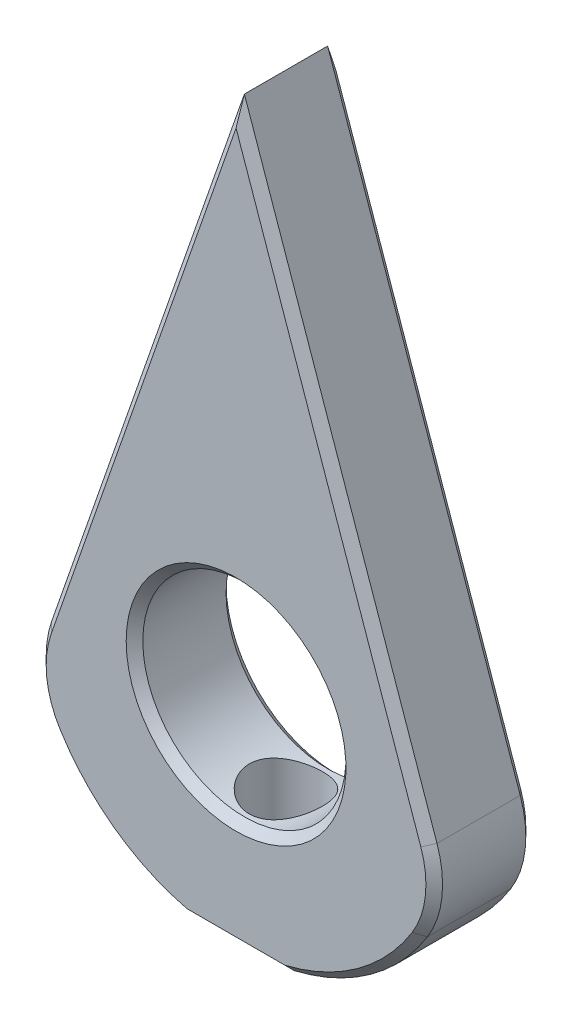
from build123d import *

# Parameters (mm, degrees)
SKIZZE1_R                            = 6.1
AUFSATZ_LINEAR_AUSTRAGEN1_DEPTH      = 6
SCHNITT_LINEAR_AUSTRAGEN1_REACH      = 48.187
SCHNITT_LINEAR_AUSTRAGEN1_END_RADIUS = 6.1
SKIZZE2_R                            = 2.2
VERRUNDUNG1_R                        = 6
FASE1_SIZE                           = 0.5


with BuildPart() as part:
    # Skizze1 → Aufsatz-Linear austragen1 (new body)
    with BuildSketch(Plane.XY):
        with BuildLine():
            Line((-3, -12.6), (3, -12.6))
            ThreePointArc((3, -12.6), (8.815176648, -9.489608035), (12.34506932, -3.919089625))
            Line((12.34506932, -3.919089625), (0, 31.5))
            Line((0, 31.5), (-12.34506932, -3.919089625))
            ThreePointArc((-12.34506932, -3.919089625), (-8.815176648, -9.489608035), (-3, -12.6))
        make_face()
        Circle(SKIZZE1_R, mode=Mode.SUBTRACT)
    extrude(amount=AUFSATZ_LINEAR_AUSTRAGEN1_DEPTH)

    # Schnitt-Linear austragen1: up to this cylinder (the profile starts outside it)
    schnitt_linear_austragen1_end = Plane(origin=(0, 0, 3), z_dir=(0, 0, -1)) * Cylinder(SCHNITT_LINEAR_AUSTRAGEN1_END_RADIUS, 109.574, mode=Mode.PRIVATE)
    # Skizze2 → Schnitt-Linear austragen1 (cut, up to the surface)
    with BuildSketch(Plane.XZ.offset(12.6), mode=Mode.PRIVATE) as schnitt_linear_austragen1_sk1:
        with Locations(Location((0, 3, 0), (0, 0, 270))):
            Circle(SKIZZE2_R)
    schnitt_linear_austragen1_tool1 = extrude(schnitt_linear_austragen1_sk1.sketch, amount=-SCHNITT_LINEAR_AUSTRAGEN1_REACH, mode=Mode.PRIVATE) - schnitt_linear_austragen1_end
    add(schnitt_linear_austragen1_tool1.solids().sort_by_distance((0, -12.6, 3))[0], mode=Mode.SUBTRACT)

    # Verrundung1
    verrundung1_edges = [part.edges().sort_by_distance(p)[0] for p in [
        (-12.34506932, -3.919089625, 3),
        (12.34506932, -3.919089625, 3),
    ]]
    fillet(verrundung1_edges, radius=VERRUNDUNG1_R)

    # Fase1
    # the kernel refuses this chamfer: 0.5 mm, written as the material it takes off along each edge
    with BuildSketch(Plane(origin=(0, 0, 6), x_dir=(0.1340527924962947, -0.9909741918051879, 0), z_dir=(-0.9909741918051879, -0.1340527924962947, 0))) as fase1_piece_1:
        Polygon((12.952219887 - FASE1_SIZE, 0), (12.952219887, -FASE1_SIZE), (12.952219887, 0), align=None)
    revolve(axis=Axis((0, 0, 6), (0, 0, 1)), revolution_arc=50.429560745, mode=Mode.SUBTRACT)
    with BuildSketch(Plane(origin=(0, 0, 0), x_dir=(1, 0, 0), z_dir=(0, -1, 0))) as fase1_piece_2:
        Polygon((6.1 + FASE1_SIZE, 0), (6.1, FASE1_SIZE), (6.1, 0), align=None)
    revolve(axis=Axis((0, 0, 0), (0, 0, 1)), mode=Mode.SUBTRACT)
    with BuildSketch(Plane(origin=(0, 0, 6), x_dir=(1, 0, 0), z_dir=(0, -1, 0))) as fase1_piece_3:
        Polygon((6.1 + FASE1_SIZE, 0), (6.1, -FASE1_SIZE), (6.1, 0), align=None)
    revolve(axis=Axis((0, 0, 6), (0, 0, 1)), mode=Mode.SUBTRACT)
    with BuildSketch(Plane(origin=(0.423201699, 32.714202895, 6), x_dir=(0.9439295829747817, -0.32899987713443074, 0.0274958766105856), z_dir=(-0.32912431347143534, -0.9442866017697998, 0)), Plane(origin=(11.570098829, -1.695631129, 6), x_dir=(-0.9439295829747814, -0.32899987713443096, 0.027495876610585616), z_dir=(-0.32912431347143556, 0.9442866017697997, 0))) as fase1_piece_4:
        Polygon((FASE1_SIZE * 0.999621916911, -FASE1_SIZE * 0.0274958766106), (-FASE1_SIZE * 0.0274958766106, -FASE1_SIZE * 0.999621916911), (0, 0), align=None)
    extrude(amount=36.440032041, mode=Mode.SUBTRACT)
    with BuildSketch(Plane(origin=(11.570098829, -1.695631129, 0), x_dir=(-0.9439295829747814, -0.32899987713443096, -0.02749587661058635), z_dir=(-0.32912431347143556, 0.9442866017697997, 0)), Plane(origin=(0.423201699, 32.714202895, 0), x_dir=(0.9439295829747817, -0.32899987713443074, -0.027495876610586334), z_dir=(-0.32912431347143534, -0.9442866017697998, 0))) as fase1_piece_5:
        Polygon((FASE1_SIZE * 0.999621916911, FASE1_SIZE * 0.0274958766106), (-FASE1_SIZE * 0.0274958766106, FASE1_SIZE * 0.999621916911), (0, 0), align=None)
    extrude(amount=36.440032041, mode=Mode.SUBTRACT)
    with BuildSketch(Plane(origin=(0, 0, 0), x_dir=(-0.8492796998321288, -0.5279431706661704, 0), z_dir=(-0.5279431706661704, 0.8492796998321288, 0))) as fase1_piece_6:
        Polygon((12.952219887, FASE1_SIZE), (12.952219887 - FASE1_SIZE, 0), (12.952219887, 0), align=None)
    revolve(axis=Axis((0, 0, 0), (0, 0, 1)), revolution_arc=50.429560745, mode=Mode.SUBTRACT)
    with BuildSketch(Plane(origin=(-5.904379219, -3.67037701, 0), x_dir=(-0.849279699832129, -0.5279431706661702, 0), z_dir=(0.5279431706661702, -0.849279699832129, 0))) as fase1_piece_7:
        Polygon((6 - FASE1_SIZE, 0), (6, -FASE1_SIZE), (6, 0), align=None)
    revolve(axis=Axis((-5.904379219, -3.67037701, 0), (0, 0, -1)), revolution_arc=51.08222172, mode=Mode.SUBTRACT)
    with BuildSketch(Plane(origin=(5.904379219, -3.67037701, 0), x_dir=(0.8492796998321291, -0.5279431706661698, 0), z_dir=(-0.5279431706661698, -0.8492796998321291, 0))) as fase1_piece_8:
        Polygon((6 - FASE1_SIZE, 0), (6, FASE1_SIZE), (6, 0), align=None)
    revolve(axis=Axis((5.904379219, -3.67037701, 0), (0, 0, 1)), revolution_arc=51.08222172, mode=Mode.SUBTRACT)
    with BuildSketch(Plane(origin=(0, 0, 6), x_dir=(-0.8492796998321288, -0.5279431706661704, 0), z_dir=(-0.5279431706661704, 0.8492796998321288, 0))) as fase1_piece_9:
        Polygon((12.952219887, -FASE1_SIZE), (12.952219887 - FASE1_SIZE, 0), (12.952219887, 0), align=None)
    revolve(axis=Axis((0, 0, 6), (0, 0, 1)), revolution_arc=50.429560745, mode=Mode.SUBTRACT)
    with BuildSketch(Plane(origin=(-5.904379219, -3.67037701, 6), x_dir=(-0.849279699832129, -0.5279431706661702, 0), z_dir=(0.5279431706661702, -0.849279699832129, 0))) as fase1_piece_10:
        Polygon((6, FASE1_SIZE), (6 - FASE1_SIZE, 0), (6, 0), align=None)
    revolve(axis=Axis((-5.904379219, -3.67037701, 6), (0, 0, -1)), revolution_arc=51.08222172, mode=Mode.SUBTRACT)
    with BuildSketch(Plane(origin=(5.904379219, -3.67037701, 6), x_dir=(0.8492796998321291, -0.5279431706661698, 0), z_dir=(-0.5279431706661698, -0.8492796998321291, 0))) as fase1_piece_11:
        Polygon((6 - FASE1_SIZE, 0), (6, -FASE1_SIZE), (6, 0), align=None)
    revolve(axis=Axis((5.904379219, -3.67037701, 6), (0, 0, 1)), revolution_arc=51.08222172, mode=Mode.SUBTRACT)
    with BuildSketch(Plane(origin=(0, 0, 0), x_dir=(0.13405279249629465, -0.9909741918051879, 0), z_dir=(-0.9909741918051879, -0.13405279249629465, 0))) as fase1_piece_12:
        Polygon((12.952219887 - FASE1_SIZE, 0), (12.952219887, FASE1_SIZE), (12.952219887, 0), align=None)
    revolve(axis=Axis((0, 0, 0), (0, 0, 1)), revolution_arc=50.429560745, mode=Mode.SUBTRACT)
    with BuildSketch(Plane(origin=(-4.285841494, -12.6, 0), x_dir=(0, 0.9996219169112968, -0.02749587661058644), z_dir=(1, 0, 0)), Plane(origin=(-4.285841494, -12.6, 6), x_dir=(0, -0.027495876610585647, -0.9996219169112968), z_dir=(1, 0, 0))) as fase1_piece_13:
        Polygon((FASE1_SIZE * 0.999621916911, FASE1_SIZE * 0.0274958766106), (-FASE1_SIZE * 0.0274958766106, FASE1_SIZE * 0.999621916911), (0, 0), align=None)
    extrude(amount=8.571682988, mode=Mode.SUBTRACT)


solid = part.part
